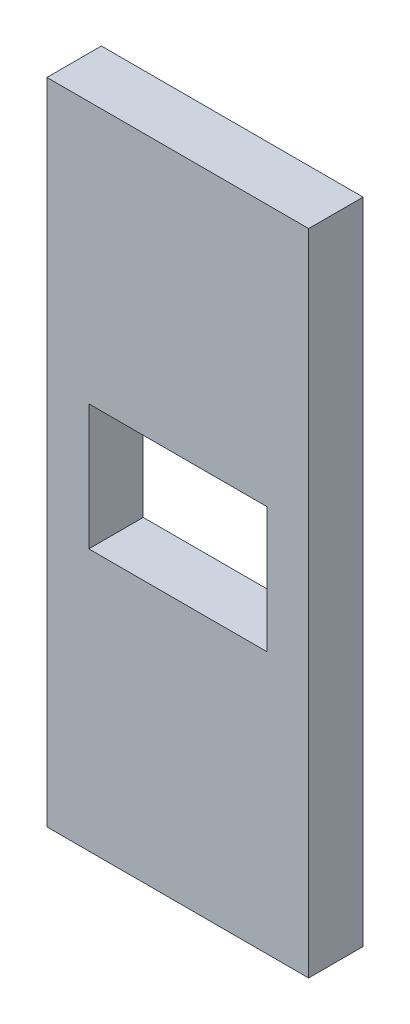
from build123d import *

# Parameters (mm, degrees)
SKETCH1_W           = 17
SKETCH1_H           = 12
BOSS_EXTRUDE1_DEPTH = 5.2


with BuildPart() as part:
    # Sketch1 → Boss-Extrude1 (new body)
    with BuildSketch(Plane.XY):
        Polygon((0, 62), (0, 42), (0, 37), (0, 25), (0, 20), (0, 0), (25, 0), (25, 20), (25, 25), (25, 37), (25, 42), (25, 62), align=None)
        with Locations((12.5, 31)):
            Rectangle(SKETCH1_W, SKETCH1_H, mode=Mode.SUBTRACT)
    extrude(amount=BOSS_EXTRUDE1_DEPTH)


solid = part.part
